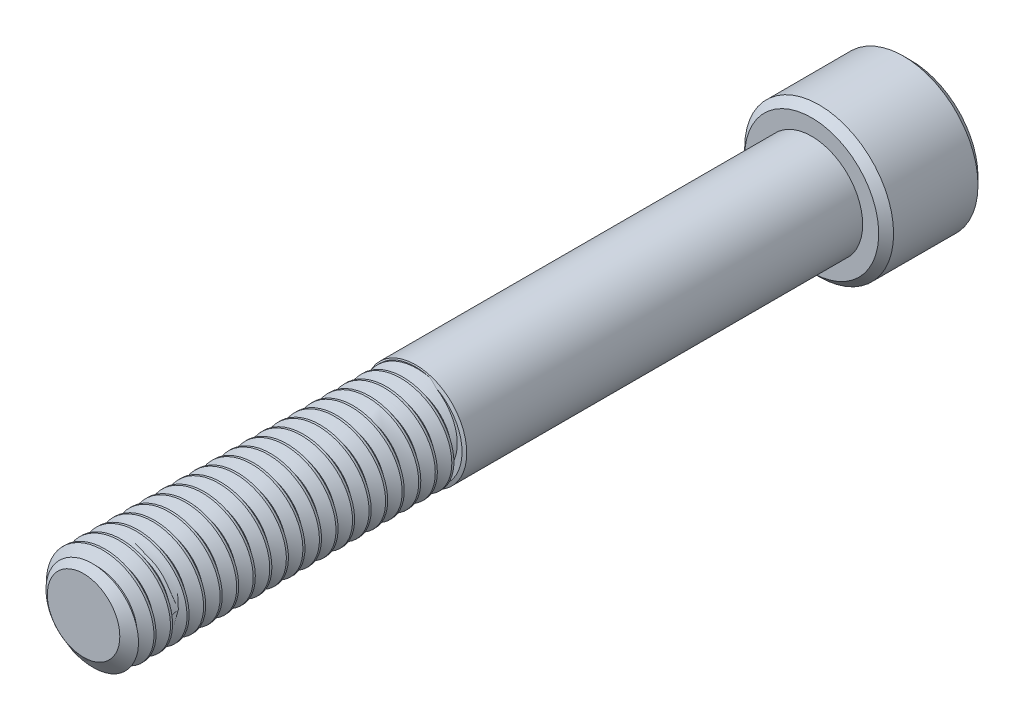
from build123d import *

# Parameters (mm, degrees)
SKETCH1_R          = 4.7625
EXTRUDE1_DEPTH     = 69.85
CUT_SWEEP1_PITCH   = 1.5875
SKETCH6_R          = 7.14375
EXTRUDE2_DEPTH     = 9.525
CUT_EXTRUDE1_DEPTH = 5.953125
CHAMFER1_SIZE      = 0.714375


with BuildPart() as part:
    # Sketch1 → Extrude1 (new body)
    with BuildSketch(Plane.XY):
        Circle(SKETCH1_R)
    extrude(amount=-EXTRUDE1_DEPTH)

    # Cut-Sweep1: arcs per turn and ends read off the stored shape
    # Cut-Sweep1: the profile of Sketch3 profile screwed along a right-hand helix through 47 turns, 6 arcs to a turn; built about Z, then put on its axis
    cut_sweep1_z = Axis((0, 0, 0), (0, 0, 1))
    cut_sweep1_corners = [(4.7628, 0, -2.976735705), (3.731388504, 0, -2.38125), (3.731388504, 0, -2.1828125), (4.7628, 0, -1.587326795)]
    with BuildLine(mode=Mode.PRIVATE) as cut_sweep1_profile:
        Line(cut_sweep1_corners[0], cut_sweep1_corners[1])
        Line(cut_sweep1_corners[1], cut_sweep1_corners[2])
        Line(cut_sweep1_corners[2], cut_sweep1_corners[3])
        Line(cut_sweep1_corners[3], cut_sweep1_corners[0])
    cut_sweep1_cap = Face(cut_sweep1_profile.wire())
    cut_sweep1_turn_angles = [0, 30, 60, 90, 120, 150, 180, 210, 240, 270, 300, 330, 360]
    cut_sweep1_turn_weights = [1, 0.8660254037844387, 1, 0.8660254037844387, 1, 0.8660254037844387, 1, 0.8660254037844387, 1, 0.8660254037844387, 1, 0.8660254037844387, 1]
    cut_sweep1_turn_rails = [Edge.make_bspline([Vector(p[0], p[1], 0).rotate(cut_sweep1_z, cut_sweep1_turn_angles[k]) / cut_sweep1_turn_weights[k] + Vector(0, 0, p[2] + CUT_SWEEP1_PITCH * cut_sweep1_turn_angles[k] / 360) for k in range(13)], [0, 0, 0, 1, 1, 2, 2, 3, 3, 4, 4, 5, 5, 6, 6, 6], 2, cut_sweep1_turn_weights) for p in cut_sweep1_corners]
    cut_sweep1_turn_sides = [Face.make_surface_from_curves(cut_sweep1_turn_rails[p[0]], cut_sweep1_turn_rails[p[1]]) for p in [(0, 1), (1, 2), (2, 3), (3, 0)]]
    cut_sweep1 = Plane(origin=(0, 0, 0), x_dir=(0, 1, 0), z_dir=(0, 0, -1)) * Solid(Shell([*[p.moved(Location((0, 0, CUT_SWEEP1_PITCH * i))) for i in range(47) for p in cut_sweep1_turn_sides], cut_sweep1_cap, cut_sweep1_cap.rotate(cut_sweep1_z, 16920).moved(Location((0, 0, CUT_SWEEP1_PITCH * 16920 / 360)))]))
    add(cut_sweep1, mode=Mode.SUBTRACT)

    # Sketch4 → Cut-Revolve1 (revolve, cut)
    with BuildSketch(Plane(origin=(0, 0, 0), x_dir=(0, 0, -1), z_dir=(1, 0, 0)), mode=Mode.PRIVATE) as cut_revolve1_sk:
        Polygon((0.899844757, 4.7625), (0, 3.477388504), (0, 4.7625), align=None)
    revolve(cut_revolve1_sk.sketch.rotate(Axis((0, 0, 0), (0, 0, -1)), 90), axis=Axis((0, 0, 0), (0, 0, -1)), mode=Mode.SUBTRACT)

    # Sketch5 → partially thread (revolve)
    with BuildSketch(Plane(origin=(0, 0, 0), x_dir=(0, 0, -1), z_dir=(1, 0, 0)), mode=Mode.PRIVATE) as partially_thread_sk:
        Polygon((69.85, 4.8895), (31.870182971, 4.8895), (31.75, 4.5593), (31.75, 0), (69.85, 0), align=None)
    revolve(partially_thread_sk.sketch.rotate(Axis((0, 0, 0), (0, 0, -1)), 90), axis=Axis((0, 0, 0), (0, 0, -1)))

    # Sketch6 → Extrude2 (add)
    with BuildSketch(Plane(origin=(0, 0, -69.85), x_dir=(-1, 0, 0), z_dir=(0, 0, -1))):
        with Locations(Location((0, 0, 0), (0, 0, 180))):
            Circle(SKETCH6_R)
    extrude(amount=EXTRUDE2_DEPTH)

    # Sketch7 → Cut-Extrude1 (cut)
    with BuildSketch(Plane(origin=(0, 0, -79.375), x_dir=(-1, 0, 0), z_dir=(0, 0, -1))):
        Polygon((0, 4.582717762), (-3.96875, 2.291358881), (-3.96875, -2.291358881), (0, -4.582717762), (3.96875, -2.291358881), (3.96875, 2.291358881), align=None)
    extrude(amount=-CUT_EXTRUDE1_DEPTH, mode=Mode.SUBTRACT)

    # Cut-Extrude2 cone 1 section (through the dimple's axis) → Cut-Extrude2 (revolve, cut)
    with BuildSketch(Plane(origin=(0, 0, -79.375), x_dir=(0, 1, 0), z_dir=(1, 0, 0))):
        Polygon((0, 0), (4.582717762, 0), (0, 4.582717762), align=None)
    revolve(axis=Axis((0, 0, -79.375), (0, 0, 1)), mode=Mode.SUBTRACT)

    # Chamfer1
    chamfer1_edges = [part.edges().sort_by_distance(p)[0] for p in [
        (-7.14375, 0, -69.85),
        (-7.14375, 0, -79.375),
    ]]
    chamfer(chamfer1_edges, length=CHAMFER1_SIZE)


solid = part.part
